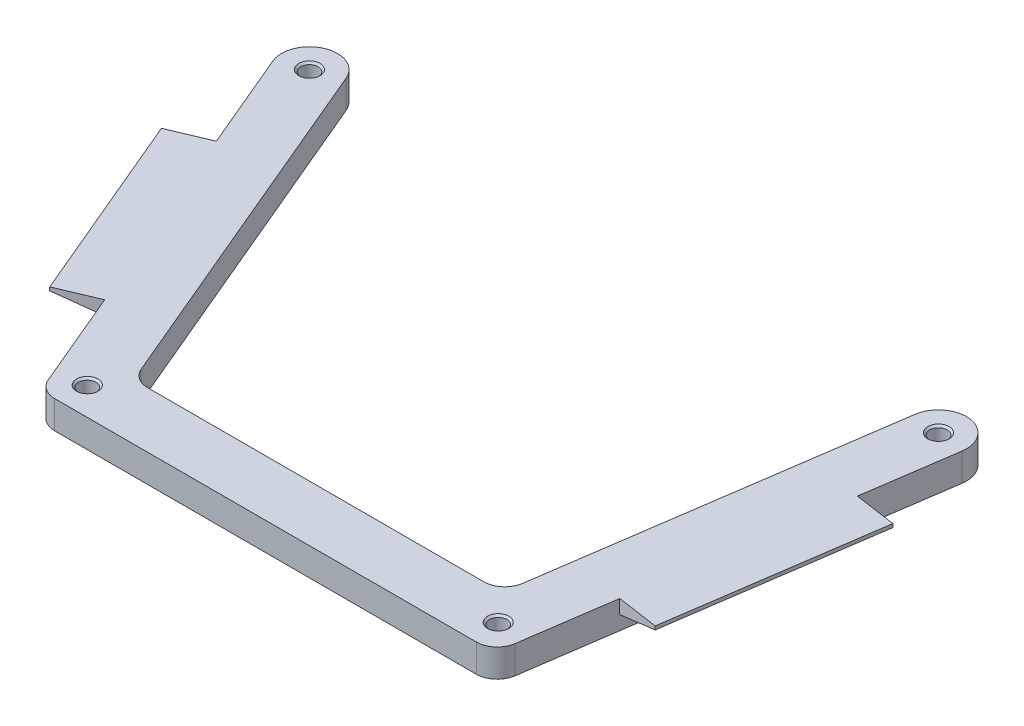
from build123d import *

# Parameters (mm, degrees)
BOSS_EXTRUDE1_DEPTH = 4
SKETCH5_R           = 2.5
CUT_EXTRUDE1_DEPTH  = 3.25
SKETCH6_W           = 30
SKETCH6_H           = 0.5
BOSS_EXTRUDE2_DEPTH = 6
BOSS_EXTRUDE3_DEPTH = 30
SKETCH8_W           = 30
SKETCH8_H           = 0.5
BOSS_EXTRUDE4_DEPTH = 6
BOSS_EXTRUDE5_DEPTH = 30


# Read off the part's stored shape, not the designer's step: M3x0.5 Tapped Hole1
with BuildPart() as part:
    # Sketch1 → Boss-Extrude1 (new body)
    with BuildSketch(Plane(origin=(0, 0, 0), x_dir=(1, 0, 0), z_dir=(0, 1, 0))):
        with BuildLine():
            Line((-26.885531635, 53.445375747), (-3.427655647, -2.16596819))
            ThreePointArc((-3.427655647, -2.16596819), (-2.322135184, -3.499790448), (-0.663506921, -4))
            Line((-0.663506921, -4), (59.665068599, -4))
            ThreePointArc((59.665068599, -4), (61.627788827, -3.268860795), (62.633827917, -1.431819537))
            Line((62.633827917, -1.431819537), (70.758345757, 54.424240617))
            ThreePointArc((70.758345757, 54.424240617), (67.375759383, 58.958345757), (62.841654243, 55.575759383))
            Line((62.841654243, 55.575759383), (55.713279127, 6.568180463))
            ThreePointArc((55.713279127, 6.568180463), (54.707240038, 4.731139205), (52.744519809, 4))
            Line((52.744519809, 4), (4.644548446, 4))
            ThreePointArc((4.644548446, 4), (2.985920183, 4.500209552), (1.88039972, 5.83403181))
            Line((1.88039972, 5.83403181), (-19.514468365, 56.554624253))
            ThreePointArc((-19.514468365, 56.554624253), (-24.754624253, 58.685531635), (-26.885531635, 53.445375747))
        make_face()
    extrude(amount=BOSS_EXTRUDE1_DEPTH)

    # M3x0.5 Tapped Hole1 outline → M3x0.5 Tapped Hole1 (revolve, cut)
    with BuildSketch(Plane(origin=(-23.2, 0, -55), x_dir=(1, 0, 0), z_dir=(0, 0, 1))):
        Polygon((0, 0), (1.25, 0), (1.25, 3.725), (1.525, 4), (0, 4), align=None)
    revolve(axis=Axis((-23.2, 0, -55), (0, 1, 0)), mode=Mode.SUBTRACT)

    # M3x0.5 Tapped Hole1 2 outline → M3x0.5 Tapped Hole1 2 (revolve, cut)
    with BuildSketch(Plane.XY):
        Polygon((0, 0), (1.25, 0), (1.25, 3.725), (1.525, 4), (0, 4), align=None)
    revolve(axis=Axis((0, 0, 0), (0, 1, 0)), mode=Mode.SUBTRACT)

    # M3x0.5 Tapped Hole1 3 outline → M3x0.5 Tapped Hole1 3 (revolve, cut)
    with BuildSketch(Plane(origin=(58.8, 0, 0), x_dir=(1, 0, 0), z_dir=(0, 0, 1))):
        Polygon((0, 0), (1.25, 0), (1.25, 3.725), (1.525, 4), (0, 4), align=None)
    revolve(axis=Axis((58.8, 0, 0), (0, 1, 0)), mode=Mode.SUBTRACT)

    # M3x0.5 Tapped Hole1 4 outline → M3x0.5 Tapped Hole1 4 (revolve, cut)
    with BuildSketch(Plane(origin=(66.8, 0, -55), x_dir=(1, 0, 0), z_dir=(0, 0, 1))):
        Polygon((0, 0), (1.25, 0), (1.25, 3.725), (1.525, 4), (0, 4), align=None)
    revolve(axis=Axis((66.8, 0, -55), (0, 1, 0)), mode=Mode.SUBTRACT)

    # Sketch5 → Cut-Extrude1 (cut)
    with BuildSketch(Plane.XZ):
        with Locations(Location((-17.4, -41.25, 0), (0, 0, 270))):
            Circle(SKETCH5_R)
        with Locations(Location((29.4, 0, 0), (0, 0, 270))):
            Circle(SKETCH5_R)
        with Locations(Location((60.8, -13.75, 0), (0, 0, 270))):
            Circle(SKETCH5_R)
        with Locations(Location((-5.8, -13.75, 0), (0, 0, 270))):
            Circle(SKETCH5_R)
        with Locations(Location((64.8, -41.25, 0), (0, 0, 270))):
            Circle(SKETCH5_R)
        with Locations(Location((-11.6, -27.5, 0), (0, 0, 270))):
            Circle(SKETCH5_R)
        with Locations(Location((14.7, 0, 0), (0, 0, 270))):
            Circle(SKETCH5_R)
        with Locations(Location((44.1, 0, 0), (0, 0, 270))):
            Circle(SKETCH5_R)
        with Locations(Location((62.8, -27.5, 0), (0, 0, 270))):
            Circle(SKETCH5_R)
    extrude(amount=-CUT_EXTRUDE1_DEPTH, mode=Mode.SUBTRACT)

    # Sketch6 → Boss-Extrude2 (add)
    with BuildSketch(Plane(origin=(-3.685531635, 0, 1.554624253), x_dir=(0.38865606330829405, 0, 0.921382908705007), z_dir=(-0.921382908705007, 0, 0.38865606330829405))):
        with Locations((-29.514686863, 3.75)):
            Rectangle(SKETCH6_W, SKETCH6_H)
    extrude(amount=BOSS_EXTRUDE2_DEPTH)

    # Sketch7 → Boss-Extrude3 (add)
    with BuildSketch(Plane(origin=(-5.641221056, 0, -13.373584401), x_dir=(0.9213829087050069, 0, -0.3886560633082941), z_dir=(0.3886560633082942, 0, 0.921382908705007))):
        Polygon((-4, 2), (-4, 3.5), (-10, 3.5), align=None)
    extrude(amount=-BOSS_EXTRUDE3_DEPTH)

    # Sketch8 → Boss-Extrude4 (add)
    with BuildSketch(Plane(origin=(61.540087421, 0, 8.951285443), x_dir=(0.14393984571411056, 0, -0.9895864392845114), z_dir=(0.9895864392845114, 0, 0.14393984571411056))):
        with Locations((35.820515092, 3.75)):
            Rectangle(SKETCH8_W, SKETCH8_H)
    extrude(amount=BOSS_EXTRUDE4_DEPTH)

    # Sketch9 → Boss-Extrude5 (add)
    with BuildSketch(Plane(origin=(2.99690173, 0, -20.603699394), x_dir=(0.9895864392845114, 0, 0.14393984571411056), z_dir=(-0.14393984571411056, 0, 0.9895864392845114))):
        Polygon((68.18768263, 3.5), (62.18768263, 3.5), (62.18768263, 2), align=None)
    extrude(amount=-BOSS_EXTRUDE5_DEPTH)


solid = part.part
